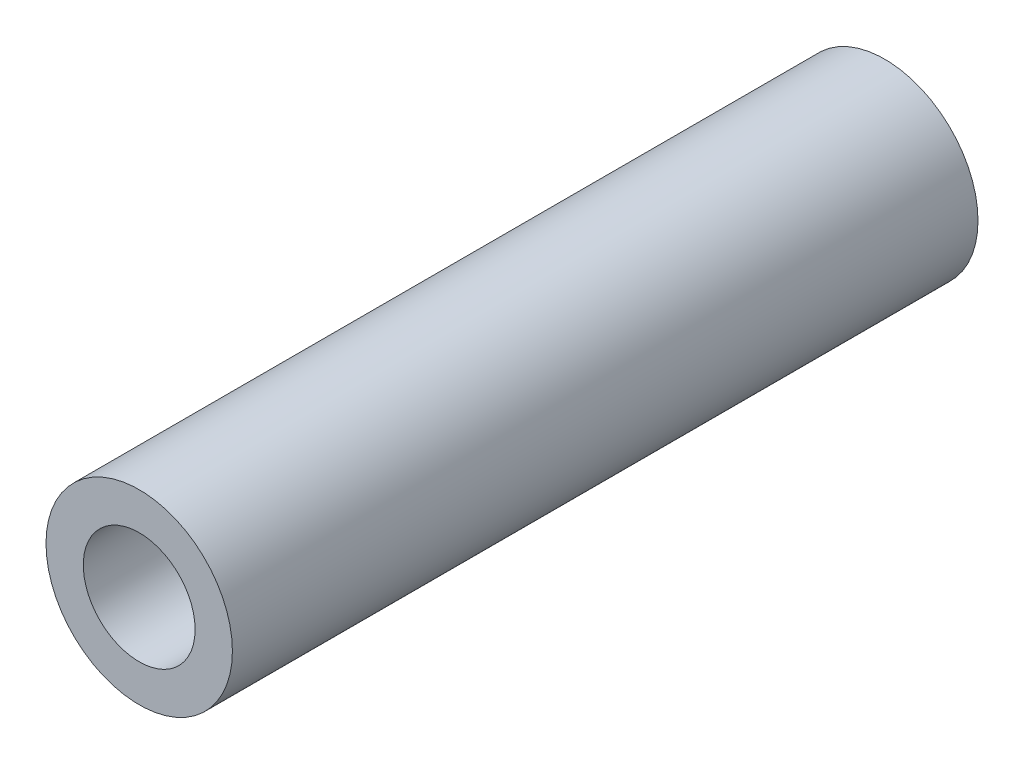
from build123d import *

# Parameters (mm, degrees)
SKETCH_1_R      = 2.5
SKETCH_1_R_2    = 1.5
EXTRUDE_1_DEPTH = 20


with BuildPart() as part:
    # 草图1 → 凸台-拉伸1 (new body)
    with BuildSketch(Plane.XY):
        Circle(SKETCH_1_R)
        Circle(SKETCH_1_R_2, mode=Mode.SUBTRACT)
    extrude(amount=EXTRUDE_1_DEPTH)


solid = part.part
